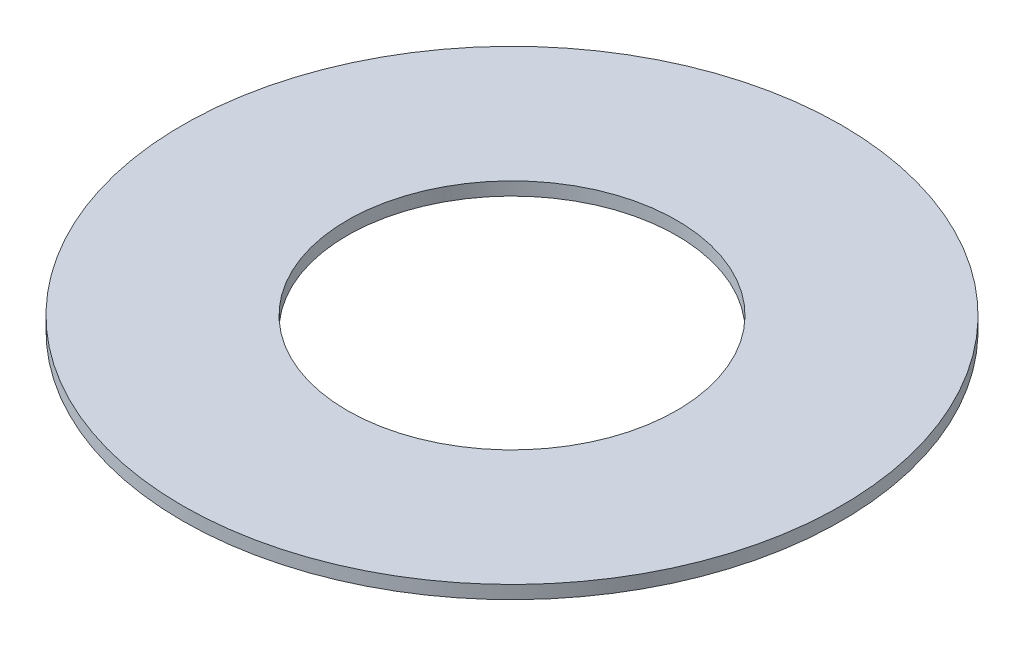
from build123d import *

# Parameters (mm, degrees)
SKETCH1_R           = 5
BOSS_EXTRUDE1_DEPTH = 0.2
SKETCH5_R           = 2.5
CUT_EXTRUDE1_DEPTH  = 8.073895674


with BuildPart() as part:
    # Sketch1 → Boss-Extrude1 (new body)
    with BuildSketch(Plane(origin=(0, 0, 0), x_dir=(1, 0, 0), z_dir=(0, 1, 0))):
        Circle(SKETCH1_R)
    extrude(amount=BOSS_EXTRUDE1_DEPTH)

    # Sketch5 → Cut-Extrude1 (cut, through all)
    with BuildSketch(Plane(origin=(0, 0.2, 0), x_dir=(-1, 0, 0), z_dir=(0, 1, 0))):
        Circle(SKETCH5_R)
    extrude(amount=-CUT_EXTRUDE1_DEPTH, mode=Mode.SUBTRACT)


solid = part.part
